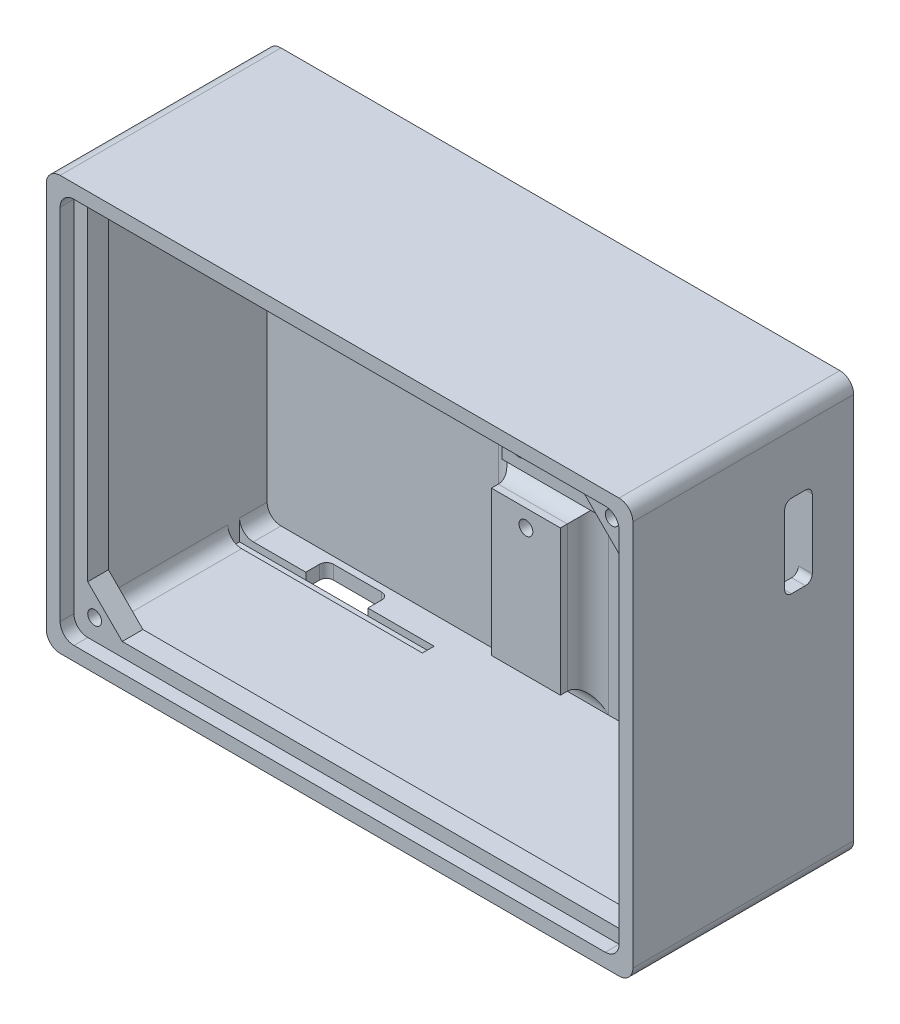
from build123d import *

# Parameters (mm, degrees)
SKETCH1_W           = 85
SKETCH1_H           = 60
BOSS_EXTRUDE1_DEPTH = 2
SKETCH2_W           = 85
SKETCH2_H           = 60
SKETCH2_W_2         = 81
SKETCH2_H_2         = 56
BOSS_EXTRUDE2_DEPTH = 30
SKETCH4_R           = 2
SKETCH4_R_2         = 1
BOSS_EXTRUDE3_DEPTH = 4
FILLET1_R           = 5
SKETCH5_W           = 34.141874229
SKETCH5_H           = 1.504357193
CUT_EXTRUDE1_DEPTH  = 1.5
FILLET2_R           = 2
CUT_EXTRUDE2_START  = -1
SKETCH6_W           = 28.2
SKETCH6_H           = 1.7
CUT_EXTRUDE2_DEPTH  = 7.5
CUT_EXTRUDE3_DEPTH  = 7.5
SKETCH8_W           = 10
SKETCH8_H           = 21
SKETCH8_R           = 1
BOSS_EXTRUDE4_DEPTH = 4
FILLET3_R           = 3
CUT_EXTRUDE4_DEPTH  = 4
SKETCH10_R          = 1
SKETCH10_W          = 25
SKETCH10_H          = 17.5
BOSS_EXTRUDE5_DEPTH = 4
BOSS_EXTRUDE6_START = -2
SKETCH11_W          = 81
SKETCH11_H          = 56
BOSS_EXTRUDE6_DEPTH = 3
FILLET4_R           = 2
SKETCH12_R          = 1
CUT_EXTRUDE5_DEPTH  = 5
SKETCH13_W          = 8
SKETCH13_H          = 4.5
CUT_EXTRUDE6_DEPTH  = 3
FILLET5_R           = 1


# Some blends are built 0.0001 mm under size
with BuildPart() as part:
    # Sketch1 → Boss-Extrude1 (new body)
    with BuildSketch(Plane.XY):
        with Locations((42.5, 30)):
            Rectangle(SKETCH1_W, SKETCH1_H)
    extrude(amount=BOSS_EXTRUDE1_DEPTH)

    # Sketch2 → Boss-Extrude2 (add)
    with BuildSketch(Plane.XY.offset(2)):
        with Locations((42.5, 30)):
            Rectangle(SKETCH2_W, SKETCH2_H)
        with Locations((42.5, 30)):
            Rectangle(SKETCH2_W_2, SKETCH2_H_2, mode=Mode.SUBTRACT)
    extrude(amount=BOSS_EXTRUDE2_DEPTH)

    # Sketch4 → Boss-Extrude3 (add)
    # profile 1 of 2: a face of its own
    with BuildSketch(Plane.XY.offset(2)):
        with Locations(Location((4.5, 54, 0), (0, 0, 180))):
            Circle(SKETCH4_R)
        with Locations((4.5, 54)):
            Circle(SKETCH4_R_2, mode=Mode.SUBTRACT)
    # profile 2 of 2: a face of its own
    with BuildSketch(Plane.XY.offset(2)):
        with Locations(Location((28.5, 54, 0), (0, 0, 180))):
            Circle(SKETCH4_R)
        with Locations((28.5, 54)):
            Circle(SKETCH4_R_2, mode=Mode.SUBTRACT)
    extrude(amount=BOSS_EXTRUDE3_DEPTH)

    # Fillet1
    # the kernel refuses this fillet: 5 mm, written as the material it adds along each edge
    with BuildSketch(Plane(origin=(4.5, 54, 2), x_dir=(-1, 0, 0), z_dir=(0, 1, 0))) as fillet1_piece_1_section:
        with BuildLine():
            CenterArc((6.898979486, 5), FILLET1_R, 191.536959033, 78.463040967)
            Line((2, 4), (2, 0))
            Line((2, 0), (6.898979486, 0))
        make_face()
    fillet1_piece_1 = revolve(axis=Axis((4.5, 54, 2), (0, 0, 1)), mode=Mode.PRIVATE)
    fillet1_piece_1 = split(fillet1_piece_1, bisect_by=Plane(origin=(2, 54, 3.119270687), z_dir=(1, 0, 0)), keep=Keep.TOP, mode=Mode.PRIVATE)
    fillet1_piece_1 = split(fillet1_piece_1, bisect_by=Plane(origin=(8.23037727, 58, 3.119270687), z_dir=(0, -1, 0)), keep=Keep.TOP, mode=Mode.PRIVATE)
    add(fillet1_piece_1)
    with BuildSketch(Plane(origin=(28.5, 54, 2), x_dir=(-1, 0, 0), z_dir=(0, 1, 0))) as fillet1_piece_2_section:
        with BuildLine():
            CenterArc((6.898979486, 5), FILLET1_R, 191.536959033, 78.463040967)
            Line((2, 4), (2, 0))
            Line((2, 0), (6.898979486, 0))
        make_face()
    fillet1_piece_2 = revolve(axis=Axis((28.5, 54, 2), (0, 0, 1)), mode=Mode.PRIVATE)
    fillet1_piece_2 = split(fillet1_piece_2, bisect_by=Plane(origin=(32.23037727, 58, 3.119270687), z_dir=(0, -1, 0)), keep=Keep.TOP, mode=Mode.PRIVATE)
    add(fillet1_piece_2)

    # Sketch5 → Cut-Extrude1 (cut)
    with BuildSketch(Plane.XY.offset(6)):
        with Locations((19.070937115, 52.032781826)):
            Rectangle(SKETCH5_W, SKETCH5_H)
    extrude(amount=-CUT_EXTRUDE1_DEPTH, mode=Mode.SUBTRACT)

    # Fillet2
    fillet2_edges = [part.edges().sort_by_distance(p)[0] for p in [
        (0, 0, 16),
        (2, 2, 17),
        (83, 2, 17),
        (85, 0, 16),
        (85, 60, 16),
        (83, 58, 17),
        (0, 60, 16),
        (2, 58, 17.250615393),
    ]]
    fillet(fillet2_edges, radius=FILLET2_R)

    # Sketch6 → Cut-Extrude2 (cut)
    with BuildSketch(Plane.XZ.offset(CUT_EXTRUDE2_START)):
        with Locations((16.1, 6.85)):
            Rectangle(SKETCH6_W, SKETCH6_H)
    extrude(amount=-CUT_EXTRUDE2_DEPTH, mode=Mode.SUBTRACT)

    # Sketch7 → Cut-Extrude3 (cut)
    with BuildSketch(Plane.XZ):
        with BuildLine():
            Line((11.6, 6), (20.6, 6))
            Line((20.6, 6), (20.6, 4))
            ThreePointArc((20.6, 4), (20.307106781, 3.292893219), (19.6, 3))
            Line((19.6, 3), (12.6, 3))
            ThreePointArc((12.6, 3), (11.892893219, 3.292893219), (11.6, 4))
            Line((11.6, 4), (11.6, 6))
        make_face()
    extrude(amount=-CUT_EXTRUDE3_DEPTH, mode=Mode.SUBTRACT)

    # Sketch8 → Boss-Extrude4 (add)
    # profile 1 of 2: a face of its own
    with BuildSketch(Plane.XY.offset(2)):
        with Locations((43.5, 15.5)):
            Rectangle(SKETCH8_W, SKETCH8_H)
        with Locations((43.5, 23.5)):
            Circle(SKETCH8_R, mode=Mode.SUBTRACT)
    # profile 2 of 2: a face of its own
    with BuildSketch(Plane.XY.offset(2)):
        with Locations((73.5, 15.5)):
            Rectangle(SKETCH8_W, SKETCH8_H)
        with Locations((73.5, 7.5)):
            Circle(SKETCH8_R, mode=Mode.SUBTRACT)
    extrude(amount=BOSS_EXTRUDE4_DEPTH)

    # Fillet3
    # the kernel refuses this fillet: 3 mm, written as the material it adds along each edge
    with BuildSketch(Plane(origin=(48.5, 26, 2), x_dir=(0, 1, 0), z_dir=(-1, 0, 0)), Plane(origin=(38.5, 5, 2), x_dir=(0, -1, 0), z_dir=(1, 0, 0)), Plane(origin=(78.5, 26, 2), x_dir=(0, 1, 0), z_dir=(-1, 0, 0)), Plane(origin=(68.5, 5, 2), x_dir=(0, -1, 0), z_dir=(1, 0, 0))) as fillet3_piece_1:
        with BuildLine():
            CenterArc((FILLET3_R, -FILLET3_R), FILLET3_R, 90, 90)
            Line((0, -FILLET3_R), (-FILLET3_R * 0.02, -FILLET3_R))
            Line((-FILLET3_R * 0.02, -FILLET3_R), (-FILLET3_R * 0.02, FILLET3_R * 0.02))
            Line((-FILLET3_R * 0.02, FILLET3_R * 0.02), (FILLET3_R, FILLET3_R * 0.02))
            Line((FILLET3_R, FILLET3_R * 0.02), (FILLET3_R, 0))
        make_face()
    extrude(amount=10)
    with BuildSketch(Plane(origin=(38.5, 26, 2), x_dir=(-1, 0, 0), z_dir=(0, -1, 0)), Plane(origin=(48.5, 5, 2), x_dir=(1, 0, 0), z_dir=(0, 1, 0)), Plane(origin=(68.5, 26, 2), x_dir=(-1, 0, 0), z_dir=(0, -1, 0)), Plane(origin=(78.5, 5, 2), x_dir=(1, 0, 0), z_dir=(0, 1, 0))) as fillet3_piece_2:
        with BuildLine():
            CenterArc((FILLET3_R, -FILLET3_R), FILLET3_R, 90, 90)
            Line((0, -FILLET3_R), (-FILLET3_R * 0.02, -FILLET3_R))
            Line((-FILLET3_R * 0.02, -FILLET3_R), (-FILLET3_R * 0.02, FILLET3_R * 0.02))
            Line((-FILLET3_R * 0.02, FILLET3_R * 0.02), (FILLET3_R, FILLET3_R * 0.02))
            Line((FILLET3_R, FILLET3_R * 0.02), (FILLET3_R, 0))
        make_face()
    extrude(amount=21)
    with BuildSketch(Plane(origin=(48.5, 5, 2), x_dir=(1, 0, 0), z_dir=(0, 1, 0))) as fillet3_piece_3a_section:
        with BuildLine():
            CenterArc((FILLET3_R, -FILLET3_R), FILLET3_R, 90, 90)
            Line((0, -FILLET3_R), (-FILLET3_R * 0.02, -FILLET3_R))
            Line((-FILLET3_R * 0.02, -FILLET3_R), (-FILLET3_R * 0.02, FILLET3_R * 0.02))
            Line((-FILLET3_R * 0.02, FILLET3_R * 0.02), (FILLET3_R, FILLET3_R * 0.02))
            Line((FILLET3_R, FILLET3_R * 0.02), (FILLET3_R, 0))
        make_face()
    fillet3_piece_3a = extrude(amount=28.5, mode=Mode.PRIVATE)
    fillet3_piece_3a = split(fillet3_piece_3a, bisect_by=Plane(origin=(49.179185343, 26, 2.679185343), z_dir=(0, 1, 0)), keep=Keep.TOP, mode=Mode.PRIVATE)
    with BuildSketch(Plane(origin=(56, 26, 2), x_dir=(0, 1, 0), z_dir=(-1, 0, 0))) as fillet3_piece_3b_section:
        with BuildLine():
            CenterArc((FILLET3_R, -FILLET3_R), FILLET3_R, 90, 90)
            Line((0, -FILLET3_R), (-FILLET3_R * 0.02, -FILLET3_R))
            Line((-FILLET3_R * 0.02, -FILLET3_R), (-FILLET3_R * 0.02, FILLET3_R * 0.02))
            Line((-FILLET3_R * 0.02, FILLET3_R * 0.02), (FILLET3_R, FILLET3_R * 0.02))
            Line((FILLET3_R, FILLET3_R * 0.02), (FILLET3_R, 0))
        make_face()
    fillet3_piece_3b = extrude(amount=17.5, mode=Mode.PRIVATE)
    fillet3_piece_3b = split(fillet3_piece_3b, bisect_by=Plane(origin=(48.5, 26.679185343, 2.679185343), z_dir=(1, 0, 0)), keep=Keep.TOP, mode=Mode.PRIVATE)
    fillet3_piece_3 = fillet3_piece_3a & fillet3_piece_3b
    add(fillet3_piece_3)
    with BuildSketch(Plane(origin=(38.5, 33.5, 2), x_dir=(-1, 0, 0), z_dir=(0, -1, 0))) as fillet3_piece_4a_section:
        with BuildLine():
            CenterArc((FILLET3_R, -FILLET3_R), FILLET3_R, 90, 90)
            Line((0, -FILLET3_R), (-FILLET3_R * 0.02, -FILLET3_R))
            Line((-FILLET3_R * 0.02, -FILLET3_R), (-FILLET3_R * 0.02, FILLET3_R * 0.02))
            Line((-FILLET3_R * 0.02, FILLET3_R * 0.02), (FILLET3_R, FILLET3_R * 0.02))
            Line((FILLET3_R, FILLET3_R * 0.02), (FILLET3_R, 0))
        make_face()
    fillet3_piece_4a = extrude(amount=28.5, mode=Mode.PRIVATE)
    fillet3_piece_4a = split(fillet3_piece_4a, bisect_by=Plane(origin=(37.820814657, 26, 2.679185343), z_dir=(0, 1, 0)), keep=Keep.TOP, mode=Mode.PRIVATE)
    with BuildSketch(Plane(origin=(48.5, 26, 2), x_dir=(0, 1, 0), z_dir=(-1, 0, 0))) as fillet3_piece_4b_section:
        with BuildLine():
            CenterArc((FILLET3_R, -FILLET3_R), FILLET3_R, 90, 90)
            Line((0, -FILLET3_R), (-FILLET3_R * 0.02, -FILLET3_R))
            Line((-FILLET3_R * 0.02, -FILLET3_R), (-FILLET3_R * 0.02, FILLET3_R * 0.02))
            Line((-FILLET3_R * 0.02, FILLET3_R * 0.02), (FILLET3_R, FILLET3_R * 0.02))
            Line((FILLET3_R, FILLET3_R * 0.02), (FILLET3_R, 0))
        make_face()
    fillet3_piece_4b = extrude(amount=17.5, mode=Mode.PRIVATE)
    fillet3_piece_4b = split(fillet3_piece_4b, bisect_by=Plane(origin=(38.5, 26.679185343, 2.679185343), z_dir=(-1, 0, 0)), keep=Keep.TOP, mode=Mode.PRIVATE)
    fillet3_piece_4 = fillet3_piece_4a & fillet3_piece_4b
    add(fillet3_piece_4)
    with BuildSketch(Plane(origin=(38.5, 26, 2), x_dir=(-1, 0, 0), z_dir=(0, -1, 0))) as fillet3_piece_5a_section:
        with BuildLine():
            CenterArc((FILLET3_R, -FILLET3_R), FILLET3_R, 90, 90)
            Line((0, -FILLET3_R), (-FILLET3_R * 0.02, -FILLET3_R))
            Line((-FILLET3_R * 0.02, -FILLET3_R), (-FILLET3_R * 0.02, FILLET3_R * 0.02))
            Line((-FILLET3_R * 0.02, FILLET3_R * 0.02), (FILLET3_R, FILLET3_R * 0.02))
            Line((FILLET3_R, FILLET3_R * 0.02), (FILLET3_R, 0))
        make_face()
    fillet3_piece_5a = extrude(amount=28.5, mode=Mode.PRIVATE)
    fillet3_piece_5a = split(fillet3_piece_5a, bisect_by=Plane(origin=(37.820814657, 5, 2.679185343), z_dir=(0, -1, 0)), keep=Keep.TOP, mode=Mode.PRIVATE)
    with BuildSketch(Plane(origin=(31, 5, 2), x_dir=(0, -1, 0), z_dir=(1, 0, 0))) as fillet3_piece_5b_section:
        with BuildLine():
            CenterArc((FILLET3_R, -FILLET3_R), FILLET3_R, 90, 90)
            Line((0, -FILLET3_R), (-FILLET3_R * 0.02, -FILLET3_R))
            Line((-FILLET3_R * 0.02, -FILLET3_R), (-FILLET3_R * 0.02, FILLET3_R * 0.02))
            Line((-FILLET3_R * 0.02, FILLET3_R * 0.02), (FILLET3_R, FILLET3_R * 0.02))
            Line((FILLET3_R, FILLET3_R * 0.02), (FILLET3_R, 0))
        make_face()
    fillet3_piece_5b = extrude(amount=17.5, mode=Mode.PRIVATE)
    fillet3_piece_5b = split(fillet3_piece_5b, bisect_by=Plane(origin=(38.5, 4.320814657, 2.679185343), z_dir=(-1, 0, 0)), keep=Keep.TOP, mode=Mode.PRIVATE)
    fillet3_piece_5 = fillet3_piece_5a & fillet3_piece_5b
    add(fillet3_piece_5)
    with BuildSketch(Plane(origin=(38.5, 5, 2), x_dir=(0, -1, 0), z_dir=(1, 0, 0))) as fillet3_piece_6a_section:
        with BuildLine():
            CenterArc((FILLET3_R, -FILLET3_R), FILLET3_R, 90, 90)
            Line((0, -FILLET3_R), (-FILLET3_R * 0.02, -FILLET3_R))
            Line((-FILLET3_R * 0.02, -FILLET3_R), (-FILLET3_R * 0.02, FILLET3_R * 0.02))
            Line((-FILLET3_R * 0.02, FILLET3_R * 0.02), (FILLET3_R, FILLET3_R * 0.02))
            Line((FILLET3_R, FILLET3_R * 0.02), (FILLET3_R, 0))
        make_face()
    fillet3_piece_6a = extrude(amount=17.5, mode=Mode.PRIVATE)
    fillet3_piece_6a = split(fillet3_piece_6a, bisect_by=Plane(origin=(48.5, 4.320814657, 2.679185343), z_dir=(1, 0, 0)), keep=Keep.TOP, mode=Mode.PRIVATE)
    with BuildSketch(Plane(origin=(48.5, -2.5, 2), x_dir=(1, 0, 0), z_dir=(0, 1, 0))) as fillet3_piece_6b_section:
        with BuildLine():
            CenterArc((FILLET3_R, -FILLET3_R), FILLET3_R, 90, 90)
            Line((0, -FILLET3_R), (-FILLET3_R * 0.02, -FILLET3_R))
            Line((-FILLET3_R * 0.02, -FILLET3_R), (-FILLET3_R * 0.02, FILLET3_R * 0.02))
            Line((-FILLET3_R * 0.02, FILLET3_R * 0.02), (FILLET3_R, FILLET3_R * 0.02))
            Line((FILLET3_R, FILLET3_R * 0.02), (FILLET3_R, 0))
        make_face()
    fillet3_piece_6b = extrude(amount=28.5, mode=Mode.PRIVATE)
    fillet3_piece_6b = split(fillet3_piece_6b, bisect_by=Plane(origin=(49.179185343, 5, 2.679185343), z_dir=(0, -1, 0)), keep=Keep.TOP, mode=Mode.PRIVATE)
    fillet3_piece_6 = fillet3_piece_6a & fillet3_piece_6b
    add(fillet3_piece_6)
    with BuildSketch(Plane(origin=(78.5, 5, 2), x_dir=(1, 0, 0), z_dir=(0, 1, 0))) as fillet3_piece_7a_section:
        with BuildLine():
            CenterArc((FILLET3_R, -FILLET3_R), FILLET3_R, 90, 90)
            Line((0, -FILLET3_R), (-FILLET3_R * 0.02, -FILLET3_R))
            Line((-FILLET3_R * 0.02, -FILLET3_R), (-FILLET3_R * 0.02, FILLET3_R * 0.02))
            Line((-FILLET3_R * 0.02, FILLET3_R * 0.02), (FILLET3_R, FILLET3_R * 0.02))
            Line((FILLET3_R, FILLET3_R * 0.02), (FILLET3_R, 0))
        make_face()
    fillet3_piece_7a = extrude(amount=28.5, mode=Mode.PRIVATE)
    fillet3_piece_7a = split(fillet3_piece_7a, bisect_by=Plane(origin=(79.179185343, 26, 2.679185343), z_dir=(0, 1, 0)), keep=Keep.TOP, mode=Mode.PRIVATE)
    with BuildSketch(Plane(origin=(86, 26, 2), x_dir=(0, 1, 0), z_dir=(-1, 0, 0))) as fillet3_piece_7b_section:
        with BuildLine():
            CenterArc((FILLET3_R, -FILLET3_R), FILLET3_R, 90, 90)
            Line((0, -FILLET3_R), (-FILLET3_R * 0.02, -FILLET3_R))
            Line((-FILLET3_R * 0.02, -FILLET3_R), (-FILLET3_R * 0.02, FILLET3_R * 0.02))
            Line((-FILLET3_R * 0.02, FILLET3_R * 0.02), (FILLET3_R, FILLET3_R * 0.02))
            Line((FILLET3_R, FILLET3_R * 0.02), (FILLET3_R, 0))
        make_face()
    fillet3_piece_7b = extrude(amount=17.5, mode=Mode.PRIVATE)
    fillet3_piece_7b = split(fillet3_piece_7b, bisect_by=Plane(origin=(78.5, 26.679185343, 2.679185343), z_dir=(1, 0, 0)), keep=Keep.TOP, mode=Mode.PRIVATE)
    fillet3_piece_7 = fillet3_piece_7a & fillet3_piece_7b
    add(fillet3_piece_7)
    with BuildSketch(Plane(origin=(68.5, 33.5, 2), x_dir=(-1, 0, 0), z_dir=(0, -1, 0))) as fillet3_piece_8a_section:
        with BuildLine():
            CenterArc((FILLET3_R, -FILLET3_R), FILLET3_R, 90, 90)
            Line((0, -FILLET3_R), (-FILLET3_R * 0.02, -FILLET3_R))
            Line((-FILLET3_R * 0.02, -FILLET3_R), (-FILLET3_R * 0.02, FILLET3_R * 0.02))
            Line((-FILLET3_R * 0.02, FILLET3_R * 0.02), (FILLET3_R, FILLET3_R * 0.02))
            Line((FILLET3_R, FILLET3_R * 0.02), (FILLET3_R, 0))
        make_face()
    fillet3_piece_8a = extrude(amount=28.5, mode=Mode.PRIVATE)
    fillet3_piece_8a = split(fillet3_piece_8a, bisect_by=Plane(origin=(67.820814657, 26, 2.679185343), z_dir=(0, 1, 0)), keep=Keep.TOP, mode=Mode.PRIVATE)
    with BuildSketch(Plane(origin=(78.5, 26, 2), x_dir=(0, 1, 0), z_dir=(-1, 0, 0))) as fillet3_piece_8b_section:
        with BuildLine():
            CenterArc((FILLET3_R, -FILLET3_R), FILLET3_R, 90, 90)
            Line((0, -FILLET3_R), (-FILLET3_R * 0.02, -FILLET3_R))
            Line((-FILLET3_R * 0.02, -FILLET3_R), (-FILLET3_R * 0.02, FILLET3_R * 0.02))
            Line((-FILLET3_R * 0.02, FILLET3_R * 0.02), (FILLET3_R, FILLET3_R * 0.02))
            Line((FILLET3_R, FILLET3_R * 0.02), (FILLET3_R, 0))
        make_face()
    fillet3_piece_8b = extrude(amount=17.5, mode=Mode.PRIVATE)
    fillet3_piece_8b = split(fillet3_piece_8b, bisect_by=Plane(origin=(68.5, 26.679185343, 2.679185343), z_dir=(-1, 0, 0)), keep=Keep.TOP, mode=Mode.PRIVATE)
    fillet3_piece_8 = fillet3_piece_8a & fillet3_piece_8b
    add(fillet3_piece_8)
    with BuildSketch(Plane(origin=(68.5, 26, 2), x_dir=(-1, 0, 0), z_dir=(0, -1, 0))) as fillet3_piece_9a_section:
        with BuildLine():
            CenterArc((FILLET3_R, -FILLET3_R), FILLET3_R, 90, 90)
            Line((0, -FILLET3_R), (-FILLET3_R * 0.02, -FILLET3_R))
            Line((-FILLET3_R * 0.02, -FILLET3_R), (-FILLET3_R * 0.02, FILLET3_R * 0.02))
            Line((-FILLET3_R * 0.02, FILLET3_R * 0.02), (FILLET3_R, FILLET3_R * 0.02))
            Line((FILLET3_R, FILLET3_R * 0.02), (FILLET3_R, 0))
        make_face()
    fillet3_piece_9a = extrude(amount=28.5, mode=Mode.PRIVATE)
    fillet3_piece_9a = split(fillet3_piece_9a, bisect_by=Plane(origin=(67.820814657, 5, 2.679185343), z_dir=(0, -1, 0)), keep=Keep.TOP, mode=Mode.PRIVATE)
    with BuildSketch(Plane(origin=(61, 5, 2), x_dir=(0, -1, 0), z_dir=(1, 0, 0))) as fillet3_piece_9b_section:
        with BuildLine():
            CenterArc((FILLET3_R, -FILLET3_R), FILLET3_R, 90, 90)
            Line((0, -FILLET3_R), (-FILLET3_R * 0.02, -FILLET3_R))
            Line((-FILLET3_R * 0.02, -FILLET3_R), (-FILLET3_R * 0.02, FILLET3_R * 0.02))
            Line((-FILLET3_R * 0.02, FILLET3_R * 0.02), (FILLET3_R, FILLET3_R * 0.02))
            Line((FILLET3_R, FILLET3_R * 0.02), (FILLET3_R, 0))
        make_face()
    fillet3_piece_9b = extrude(amount=17.5, mode=Mode.PRIVATE)
    fillet3_piece_9b = split(fillet3_piece_9b, bisect_by=Plane(origin=(68.5, 4.320814657, 2.679185343), z_dir=(-1, 0, 0)), keep=Keep.TOP, mode=Mode.PRIVATE)
    fillet3_piece_9 = fillet3_piece_9a & fillet3_piece_9b
    add(fillet3_piece_9)
    with BuildSketch(Plane(origin=(68.5, 5, 2), x_dir=(0, -1, 0), z_dir=(1, 0, 0))) as fillet3_piece_10a_section:
        with BuildLine():
            CenterArc((FILLET3_R, -FILLET3_R), FILLET3_R, 90, 90)
            Line((0, -FILLET3_R), (-FILLET3_R * 0.02, -FILLET3_R))
            Line((-FILLET3_R * 0.02, -FILLET3_R), (-FILLET3_R * 0.02, FILLET3_R * 0.02))
            Line((-FILLET3_R * 0.02, FILLET3_R * 0.02), (FILLET3_R, FILLET3_R * 0.02))
            Line((FILLET3_R, FILLET3_R * 0.02), (FILLET3_R, 0))
        make_face()
    fillet3_piece_10a = extrude(amount=17.5, mode=Mode.PRIVATE)
    fillet3_piece_10a = split(fillet3_piece_10a, bisect_by=Plane(origin=(78.5, 4.320814657, 2.679185343), z_dir=(1, 0, 0)), keep=Keep.TOP, mode=Mode.PRIVATE)
    with BuildSketch(Plane(origin=(78.5, -2.5, 2), x_dir=(1, 0, 0), z_dir=(0, 1, 0))) as fillet3_piece_10b_section:
        with BuildLine():
            CenterArc((FILLET3_R, -FILLET3_R), FILLET3_R, 90, 90)
            Line((0, -FILLET3_R), (-FILLET3_R * 0.02, -FILLET3_R))
            Line((-FILLET3_R * 0.02, -FILLET3_R), (-FILLET3_R * 0.02, FILLET3_R * 0.02))
            Line((-FILLET3_R * 0.02, FILLET3_R * 0.02), (FILLET3_R, FILLET3_R * 0.02))
            Line((FILLET3_R, FILLET3_R * 0.02), (FILLET3_R, 0))
        make_face()
    fillet3_piece_10b = extrude(amount=28.5, mode=Mode.PRIVATE)
    fillet3_piece_10b = split(fillet3_piece_10b, bisect_by=Plane(origin=(79.179185343, 5, 2.679185343), z_dir=(0, -1, 0)), keep=Keep.TOP, mode=Mode.PRIVATE)
    fillet3_piece_10 = fillet3_piece_10a & fillet3_piece_10b
    add(fillet3_piece_10)

    # Sketch9 → Cut-Extrude4 (cut)
    with BuildSketch(Plane(origin=(85, 0, 0), x_dir=(0, 0, -1), z_dir=(1, 0, 0))):
        with BuildLine():
            Line((-7, 49.5), (-9, 49.5))
            ThreePointArc((-9, 49.5), (-9.707106781, 49.207106781), (-10, 48.5))
            Line((-10, 48.5), (-10, 38.5))
            ThreePointArc((-10, 38.5), (-9.707106781, 37.792893219), (-9, 37.5))
            Line((-9, 37.5), (-7, 37.5))
            ThreePointArc((-7, 37.5), (-6.292893219, 37.792893219), (-6, 38.5))
            Line((-6, 38.5), (-6, 48.5))
            ThreePointArc((-6, 48.5), (-6.292893219, 49.207106781), (-7, 49.5))
        make_face()
    extrude(amount=-CUT_EXTRUDE4_DEPTH, mode=Mode.SUBTRACT)

    # Sketch10 → Boss-Extrude5 (add)
    with BuildSketch(Plane.XY.offset(2)):
        with BuildLine():
            Line((40, 56.897136512), (74, 56.897136512))
            add(Edge.make_bspline(
                [(74, 56.897136512), (76.595150543, 53.237161872), (81, 52.397136512)],
                knots=[0, 0, 0, 1, 1, 1], degree=2))
            Line((81, 52.397136512), (83, 52.397136512))
            Line((83, 52.397136512), (83, 34.897136512))
            Line((83, 34.897136512), (81, 34.897136512))
            add(Edge.make_bspline(
                [(74, 30.397136512), (76.595150543, 34.057111151), (81, 34.897136512)],
                knots=[0, 0, 0, 1, 1, 1], degree=2))
            Line((74, 30.397136512), (40, 30.397136512))
            Line((40, 30.397136512), (40, 56.897136512))
        make_face()
        with Locations((42.5, 54.397136512)):
            Circle(SKETCH10_R, mode=Mode.SUBTRACT)
        with Locations((42.5, 32.897136512)):
            Circle(SKETCH10_R, mode=Mode.SUBTRACT)
        with Locations((71.5, 54.397136512)):
            Circle(SKETCH10_R, mode=Mode.SUBTRACT)
        with Locations((71.5, 32.897136512)):
            Circle(SKETCH10_R, mode=Mode.SUBTRACT)
        with Locations((78.5, 50.397136512)):
            Circle(SKETCH10_R, mode=Mode.SUBTRACT)
        with Locations((78.5, 36.897136512)):
            Circle(SKETCH10_R, mode=Mode.SUBTRACT)
        with Locations((57, 43.647136512)):
            Rectangle(SKETCH10_W, SKETCH10_H, mode=Mode.SUBTRACT)
    extrude(amount=BOSS_EXTRUDE5_DEPTH)

    # Sketch11 → Boss-Extrude6 (add)
    with BuildSketch(Plane.XY.offset(32).offset(BOSS_EXTRUDE6_START)):
        with Locations((42.5, 30)):
            Rectangle(SKETCH11_W, SKETCH11_H)
        Polygon((4, 56), (76, 56), (81, 51), (81, 4), (9, 4), (4, 9), align=None, mode=Mode.SUBTRACT)
    extrude(amount=-BOSS_EXTRUDE6_DEPTH)

    # Fillet4
    fillet4_edges = [part.edges().sort_by_distance(p)[0] for p in [
        (2.585786438, 57.414213562, 27),
        (42.5, 2, 27),
        (83, 30, 27),
        (2, 30, 27),
        (42.5, 58, 27),
        (2.585786438, 2.585786438, 27),
        (82.414213562, 57.414213562, 27),
        (82.414213562, 2.585786438, 27),
    ]]
    fillet(fillet4_edges, radius=FILLET4_R - 0.0001)  # a hair under: the kernel refuses the full size

    # Sketch12 → Cut-Extrude5 (cut)
    with BuildSketch(Plane.XY.offset(30)):
        with Locations((5, 5)):
            Circle(SKETCH12_R)
        with Locations((80, 55)):
            Circle(SKETCH12_R)
    extrude(amount=-CUT_EXTRUDE5_DEPTH, mode=Mode.SUBTRACT)

    # Sketch13 → Cut-Extrude6 (cut)
    with BuildSketch(Plane.XY.offset(6)):
        with Locations((64, 32.647136512)):
            Rectangle(SKETCH13_W, SKETCH13_H)
    extrude(amount=-CUT_EXTRUDE6_DEPTH, mode=Mode.SUBTRACT)

    # Fillet5
    fillet5_edges = [part.edges().sort_by_distance(p)[0] for p in [
        (60, 32.647136512, 3),
        (68, 32.647136512, 3),
        (60, 32.647136512, 6),
        (68, 32.647136512, 6),
    ]]
    fillet(fillet5_edges, radius=FILLET5_R)


solid = part.part
